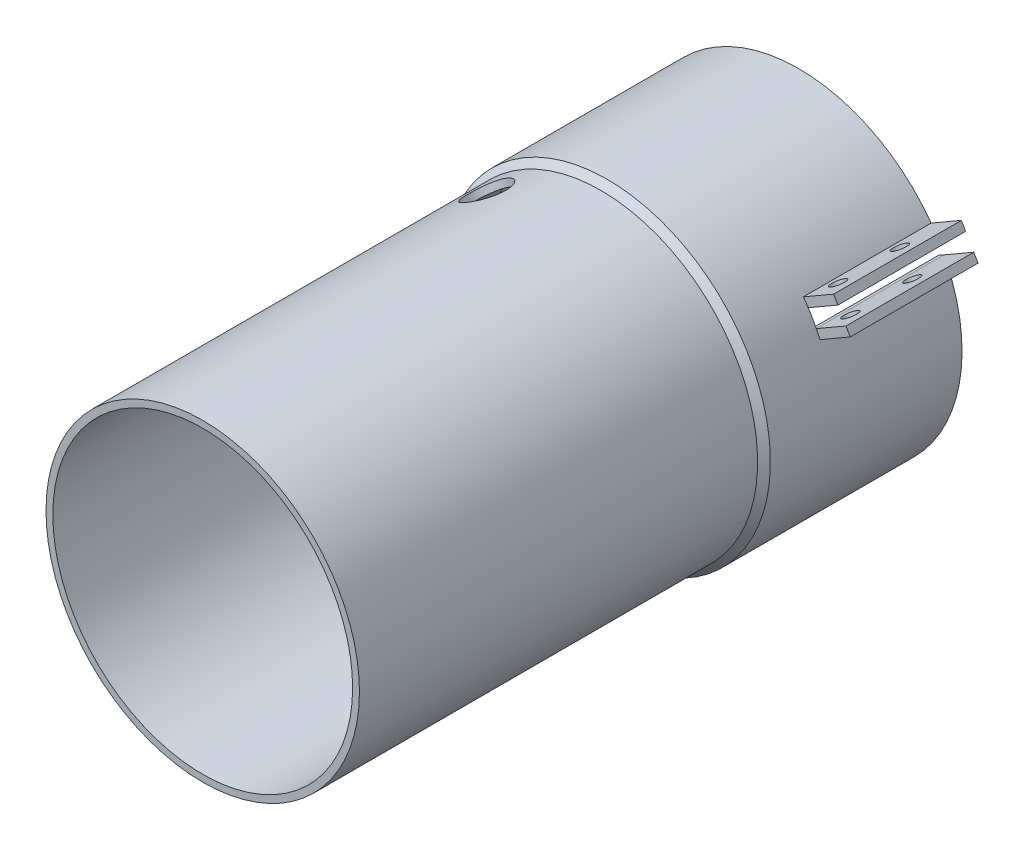
from build123d import *

# Parameters (mm, degrees)
SKETCH1_R                = 36.8
SKETCH1_R_2              = 35.2
BOSS_EXTRUDE1_DEPTH      = 100
BOSS_EXTRUDE2_DEPTH      = 10
BOSS_EXTRUDE2_DEPTH_BACK = 5
SKETCH2_R                = 38.3
SKETCH2_R_2              = 36.8
CHAMFER1_SIZE            = 1.5
BOSS_EXTRUDE3_START      = 30
BOSS_EXTRUDE3_DEPTH      = 30
SKETCH7_R                = 1.75
CUT_EXTRUDE1_DEPTH       = 116.043019012
CUT_EXTRUDE2_REACH       = 153.112
CUT_EXTRUDE3_REACH       = 138.3
CUT_EXTRUDE3_END_RADIUS  = 35.2
SKETCH9_R                = 5


with BuildPart() as part:
    # Sketch1 → Boss-Extrude1 (new body)
    with BuildSketch(Plane.XY):
        Circle(SKETCH1_R)
        Circle(SKETCH1_R_2, mode=Mode.SUBTRACT)
    extrude(amount=BOSS_EXTRUDE1_DEPTH)

    # Sketch2 → Boss-Extrude2 (add, two sides: drawn at the far end of the back side and taken through both)
    with BuildSketch(Plane(origin=(0, 0, 0), x_dir=(-1, 0, 0), z_dir=(0, 0, -1)).offset(-BOSS_EXTRUDE2_DEPTH_BACK)):
        Circle(SKETCH2_R)
        Circle(SKETCH2_R_2, mode=Mode.SUBTRACT)
    extrude(amount=BOSS_EXTRUDE2_DEPTH + BOSS_EXTRUDE2_DEPTH_BACK)

    # Chamfer1
    chamfer1_edges = [part.edges().sort_by_distance(p)[0] for p in [
        (-36.8, 0, 5),
    ]]
    chamfer(chamfer1_edges, length=CHAMFER1_SIZE - 0.0001)  # a hair under: the kernel refuses the full size

    # Sketch6 → Boss-Extrude3 (add)
    with BuildSketch(Plane(origin=(0, 0, -10), x_dir=(-1, 0, 0), z_dir=(0, 0, -1)).offset(BOSS_EXTRUDE3_START)):
        with BuildLine():
            Line((-31.046363436, 22.427958387), (-32.43120853, 23.227499075))
            Line((-32.43120853, 23.227499075), (-35.462297443, 24.977499075))
            Line((-35.462297443, 24.977499075), (-38.147666087, 26.527897384))
            Line((-38.147666087, 26.527897384), (-39.147666087, 24.795846576))
            Line((-39.147666087, 24.795846576), (-36.462297443, 23.245448267))
            Line((-36.462297443, 23.245448267), (-33.43120853, 21.495448267))
            Line((-33.43120853, 21.495448267), (-32.177933832, 20.771869783))
            Line((-32.177933832, 20.771869783), (-30.861043972, 20.045846576))
            ThreePointArc((-30.861043972, 20.045846576), (18.4, 31.869734859), (32.790734361, -16.703524779))
            Line((32.790734361, -16.703524779), (34.077933832, -17.480973249))
            Line((34.077933832, -17.480973249), (35.33120853, -18.204551733))
            Line((35.33120853, -18.204551733), (38.362297443, -19.954551733))
            Line((38.362297443, -19.954551733), (41.047666087, -21.504950042))
            Line((41.047666087, -21.504950042), (42.047666087, -19.772899234))
            Line((42.047666087, -19.772899234), (39.362297443, -18.222500925))
            Line((39.362297443, -18.222500925), (36.33120853, -16.472500925))
            Line((36.33120853, -16.472500925), (34.946363436, -15.672960237))
            ThreePointArc((34.946363436, -15.672960237), (19.15, 33.168772965), (-31.046363436, 22.427958387))
        make_face()
        with BuildLine():
            Line((-34.946363436, 15.672960237), (-36.33120853, 16.472500925))
            Line((-36.33120853, 16.472500925), (-39.362297443, 18.222500925))
            Line((-39.362297443, 18.222500925), (-42.047666087, 19.772899234))
            Line((-42.047666087, 19.772899234), (-41.047666087, 21.504950042))
            Line((-41.047666087, 21.504950042), (-38.362297443, 19.954551733))
            Line((-38.362297443, 19.954551733), (-35.33120853, 18.204551733))
            Line((-35.33120853, 18.204551733), (-34.077933832, 17.480973249))
            Line((-34.077933832, 17.480973249), (-32.743288904, 16.796339832))
            ThreePointArc((-32.743288904, 16.796339832), (-18.4, -31.869734859), (30.917701437, -19.958350079))
            Line((30.917701437, -19.958350079), (32.177933832, -20.771869783))
            Line((32.177933832, -20.771869783), (33.43120853, -21.495448267))
            Line((33.43120853, -21.495448267), (36.462297443, -23.245448267))
            Line((36.462297443, -23.245448267), (39.147666087, -24.795846576))
            Line((39.147666087, -24.795846576), (38.147666087, -26.527897384))
            Line((38.147666087, -26.527897384), (35.462297443, -24.977499075))
            Line((35.462297443, -24.977499075), (32.43120853, -23.227499075))
            Line((32.43120853, -23.227499075), (31.046363436, -22.427958387))
            ThreePointArc((31.046363436, -22.427958387), (-19.15, -33.168772965), (-34.946363436, 15.672960237))
        make_face()
    extrude(amount=-BOSS_EXTRUDE3_DEPTH)

    # Sketch7 → Cut-Extrude1 (cut, symmetric)
    with BuildSketch(Plane(origin=(0, 0, 0), x_dir=(0, 0, 1), z_dir=(0.500000000000001, -0.866025403784438, 0))):
        with Locations(Location((-29.75, 41.45, 0), (0, 0, 270))):
            Circle(SKETCH7_R)
        with Locations(Location((-15.25, 41.45, 0), (0, 0, 270))):
            Circle(SKETCH7_R)
    cut_extrude1 = extrude(amount=CUT_EXTRUDE1_DEPTH, both=True, mode=Mode.SUBTRACT)

    # Mirror1: Cut-Extrude1 across plane
    add(cut_extrude1.mirror(Plane(origin=(0, 0, 0), x_dir=(0, 0, 1), z_dir=(0.866025403784438, 0.500000000000001, 0))), mode=Mode.SUBTRACT)

    # Cut-Extrude2: up to this face of the body (flat: up to its plane)
    cut_extrude2_end = Plane(part.part.faces().sort_by_distance((35.759138818, 0, 0))[0])
    # Sketch8 → Cut-Extrude2 (cut, up to the picked face)
    with BuildSketch(Plane(origin=(0, 0, -40), x_dir=(-1, 0, 0), z_dir=(0, 0, -1)), mode=Mode.PRIVATE) as cut_extrude2_sk1:
        with BuildLine():
            ThreePointArc((31.085732423, -20.066819373), (32.069109105, -18.454599459), (32.968944874, -16.794304805))
            ThreePointArc((32.968944874, -16.794304805), (18.5, 32.04293994), (-31.028767037, 20.154791395))
            ThreePointArc((-31.028767037, 20.154791395), (-32.016706501, 18.545363432), (-32.921241561, 16.887624287))
            ThreePointArc((-32.921241561, 16.887624287), (-18.5, -32.04293994), (31.085732423, -20.066819373))
        make_face()
    cut_extrude2_tool1 = split(extrude(cut_extrude2_sk1.sketch, amount=-CUT_EXTRUDE2_REACH, mode=Mode.PRIVATE), bisect_by=cut_extrude2_end, keep=Keep.BOTH, mode=Mode.PRIVATE)
    add(cut_extrude2_tool1.solids().sort_by(Axis((0, 0, -40), (0, 0, 1)))[0], mode=Mode.SUBTRACT)

    # Cut-Extrude3: up to this cylinder (the profile starts outside it)
    cut_extrude3_end = Plane(origin=(0, 0, 15), z_dir=(0, 0, -1)) * Cylinder(CUT_EXTRUDE3_END_RADIUS, 348, mode=Mode.PRIVATE)
    # Sketch9 → Cut-Extrude3 (cut, up to the surface)
    with BuildSketch(Plane(origin=(-18.4, 31.869734859, 0), x_dir=(0.8660254037844382, 0.500000000000001, 0), z_dir=(-0.500000000000001, 0.8660254037844382, 0)), mode=Mode.PRIVATE) as cut_extrude3_sk1:
        with Locations(Location((0, -15, 0), (0, 0, 180))):
            Circle(SKETCH9_R)
    cut_extrude3_tool1 = extrude(cut_extrude3_sk1.sketch, amount=-CUT_EXTRUDE3_REACH, mode=Mode.PRIVATE) - cut_extrude3_end
    add(cut_extrude3_tool1.solids().sort_by_distance((-18.4, 31.869735, 15))[0], mode=Mode.SUBTRACT)


solid = part.part
